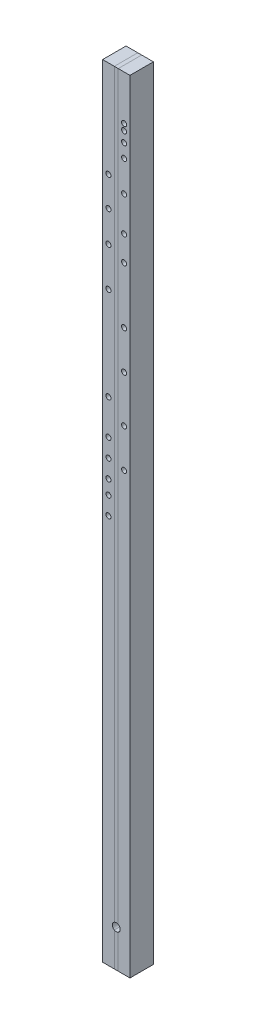
from build123d import *

# Parameters (mm, degrees)
SKETCH1_W           = 38.1
SKETCH1_H           = 1270
BOSS_EXTRUDE1_DEPTH = 3.175
SKETCH8_W           = 38.1
SKETCH8_H           = 1270
BOSS_EXTRUDE2_DEPTH = 19.05
SKETCH2_R           = 6.35
CUT_EXTRUDE1_DEPTH  = 637.530094045
SKETCH5_R           = 1.905
CUT_EXTRUDE3_DEPTH  = 637.530094045
SKETCH6_R           = 4.1275
CUT_EXTRUDE4_DEPTH  = 7.747


with BuildPart() as part:
    # Sketch1 → Boss-Extrude1 (new, symmetric)
    with BuildSketch(Plane(origin=(0, 0, 0), x_dir=(0, 0, -1), z_dir=(1, 0, 0))):
        Rectangle(SKETCH1_W, SKETCH1_H)
    extrude(amount=BOSS_EXTRUDE1_DEPTH, both=True)


with BuildPart() as body_2:
    # Sketch8 → Boss-Extrude2 (new body)
    with BuildSketch(Plane(origin=(3.175, 0, 0), x_dir=(0, 0, -1), z_dir=(1, 0, 0))):
        Rectangle(SKETCH8_W, SKETCH8_H)
    extrude(amount=BOSS_EXTRUDE2_DEPTH)


with BuildPart() as body_3:
    # Mirror3: mirrored copy
    add(body_2.part.mirror(Plane(origin=(0, 0, 0), x_dir=(0, 0, 1), z_dir=(1, 0, 0))))


with BuildPart() as cut_extrude1_tool:
    # Sketch2 → Cut-Extrude1 (new, through all)
    with BuildSketch(Plane.XY.offset(19.05)):
        with Locations((0, -574.675)):
            Circle(SKETCH2_R)
    extrude(amount=-CUT_EXTRUDE1_DEPTH)


with BuildPart() as part_1:
    add(part.part)

    # Cut-Extrude1: cut by cut_extrude1_tool
    add(cut_extrude1_tool.part, mode=Mode.SUBTRACT)


with BuildPart() as body_2_1:
    add(body_2.part)

    # Cut-Extrude1: cut by cut_extrude1_tool
    add(cut_extrude1_tool.part, mode=Mode.SUBTRACT)


with BuildPart() as body_3_1:
    add(body_3.part)

    # Cut-Extrude1: cut by cut_extrude1_tool
    add(cut_extrude1_tool.part, mode=Mode.SUBTRACT)


with BuildPart() as cut_extrude3_tool:
    # Sketch5 → Cut-Extrude3 (new, through all)
    with BuildSketch(Plane.XY.offset(19.05)):
        with Locations((12.7, 513.302135886)):
            Circle(SKETCH5_R)
        with Locations((-12.7, 478.263647874)):
            Circle(SKETCH5_R)
        with Locations((12.7, 463.345550332)):
            Circle(SKETCH5_R)
        with Locations((-12.7, 430.113859098)):
            Circle(SKETCH5_R)
        with Locations((12.7, 407.064148942)):
            Circle(SKETCH5_R)
        with Locations((-12.7, 379.842698104)):
            Circle(SKETCH5_R)
        with Locations((12.7, 366.551491472)):
            Circle(SKETCH5_R)
        with Locations((-12.7, 316.418969048)):
            Circle(SKETCH5_R)
        with Locations((12.7, 535.422112699)):
            Circle(SKETCH5_R)
        with Locations((12.7, 552.28498253)):
            Circle(SKETCH5_R)
        with Locations((12.7, 562.430692594)):
            Circle(SKETCH5_R)
        with Locations((-12.7, 165.149796436)):
            Circle(SKETCH5_R)
        with Locations((-12.7, 108.45633512)):
            Circle(SKETCH5_R)
        with Locations((-12.7, 79.058526758)):
            Circle(SKETCH5_R)
        with Locations((-12.7, 49.653866377)):
            Circle(SKETCH5_R)
        with Locations((-12.7, 27.043187605)):
            Circle(SKETCH5_R)
        with Locations((-12.7, -2.198894726)):
            Circle(SKETCH5_R)
        with Locations((12.7, 74.386924519)):
            Circle(SKETCH5_R)
        with Locations((12.7, 137.013245544)):
            Circle(SKETCH5_R)
        with Locations((12.7, 212.596714918)):
            Circle(SKETCH5_R)
        with Locations((12.7, 275.179690854)):
            Circle(SKETCH5_R)
    extrude(amount=-CUT_EXTRUDE3_DEPTH)


with BuildPart() as body_2_2:
    add(body_2_1.part)

    # Cut-Extrude3: cut by cut_extrude3_tool
    add(cut_extrude3_tool.part, mode=Mode.SUBTRACT)


with BuildPart() as body_3_2:
    add(body_3_1.part)

    # Cut-Extrude3: cut by cut_extrude3_tool
    add(cut_extrude3_tool.part, mode=Mode.SUBTRACT)


with BuildPart() as cut_extrude4_tool:
    # Sketch6 → Cut-Extrude4 (new body)
    with BuildSketch(Plane.XY.offset(19.05)):
        with Locations((12.7, 513.302135886)):
            Circle(SKETCH6_R)
        with Locations((-12.7, 478.263647874)):
            Circle(SKETCH6_R)
        with Locations((12.7, 463.345550332)):
            Circle(SKETCH6_R)
        with Locations((-12.7, 430.113859098)):
            Circle(SKETCH6_R)
        with Locations((-12.7, 379.842698104)):
            Circle(SKETCH6_R)
        with Locations((-12.7, 316.418969048)):
            Circle(SKETCH6_R)
        with Locations((12.7, 366.551491472)):
            Circle(SKETCH6_R)
        with Locations((12.7, 407.064148942)):
            Circle(SKETCH6_R)
        with Locations((12.7, 562.430692594)):
            Circle(SKETCH6_R)
        with Locations((12.7, 552.28498253)):
            Circle(SKETCH6_R)
        with Locations((12.7, 535.422112699)):
            Circle(SKETCH6_R)
        with Locations((12.7, 275.179690854)):
            Circle(SKETCH6_R)
        with Locations((12.7, 212.596714918)):
            Circle(SKETCH6_R)
        with Locations((-12.7, 165.149796436)):
            Circle(SKETCH6_R)
        with Locations((12.7, 137.013245544)):
            Circle(SKETCH6_R)
        with Locations((-12.7, 108.45633512)):
            Circle(SKETCH6_R)
        with Locations((-12.7, 79.058526758)):
            Circle(SKETCH6_R)
        with Locations((12.7, 74.386924519)):
            Circle(SKETCH6_R)
        with Locations((-12.7, 49.653866377)):
            Circle(SKETCH6_R)
        with Locations((-12.7, 27.043187605)):
            Circle(SKETCH6_R)
        with Locations((-12.7, -2.198894726)):
            Circle(SKETCH6_R)
    extrude(amount=-CUT_EXTRUDE4_DEPTH)


with BuildPart() as body_2_3:
    add(body_2_2.part)

    # Cut-Extrude4: cut by cut_extrude4_tool
    add(cut_extrude4_tool.part, mode=Mode.SUBTRACT)


with BuildPart() as body_3_3:
    add(body_3_2.part)

    # Cut-Extrude4: cut by cut_extrude4_tool
    add(cut_extrude4_tool.part, mode=Mode.SUBTRACT)


solid = Compound([part_1.part, body_2_3.part, body_3_3.part])
